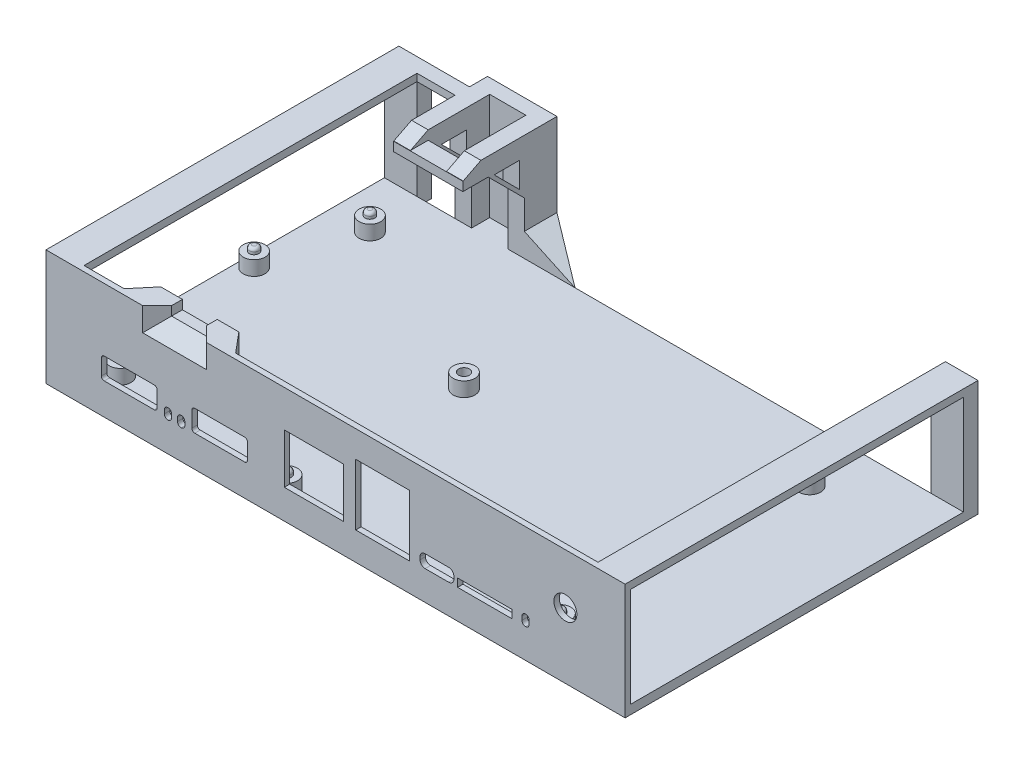
from build123d import *
from OCP.BRepFilletAPI import BRepFilletAPI_MakeChamfer

# Parameters (mm, degrees)
BOSS_EXTRUDE1_DEPTH  = 2.5
SKETCH3_W            = 160
SKETCH3_H            = 1.5
BOSS_EXTRUDE2_DEPTH  = 32
SKETCH4_R            = 3
BOSS_EXTRUDE3_DEPTH  = 4
SKETCH6_R            = 1.33
BOSS_EXTRUDE5_DEPTH  = 1.5
SKETCH7_R            = 1.5
CUT_EXTRUDE1_DEPTH   = 4
BOSS_EXTRUDE6_DEPTH  = 32
BOSS_EXTRUDE7_DEPTH  = 2.5
CHAMFER2_SIZE        = 6.5
CHAMFER2_SIZE2       = 13.939294983
CUT_EXTRUDE2_REACH   = 194.692
SKETCH11_R           = 3.175
SKETCH11_W           = 15.4
SKETCH11_H           = 5.95
SKETCH11_W_2         = 16.33
SKETCH11_H_2         = 13.74
SKETCH11_W_3         = 14.9
SKETCH11_H_3         = 16.92
SKETCH11_W_4         = 9.34
SKETCH11_H_4         = 3.56
SKETCH11_W_5         = 15.1
SKETCH11_H_5         = 2.25
SKETCH11_W_6         = 2
SKETCH11_H_6         = 3
SKETCH11_W_7         = 9.6
SKETCH11_H_7         = 2.5
FILLET1_R            = 1.4
FILLET2_R            = 0.8
FILLET3_R            = 0.8
FILLET4_R            = 1
BOSS_EXTRUDE8_DEPTH  = 5.5
CHAMFER3_SIZE        = 5.5
CHAMFER4_SIZE        = 4.6
CHAMFER4_SIZE2       = 5.482066526
CHAMFER5_SIZE        = 4
SKETCH13_W           = 4.5825757
SKETCH13_H           = 12
SKETCH13_W_2         = 4.582575695
BOSS_EXTRUDE9_DEPTH  = 5
SKETCH16_W           = 19.16515139
SKETCH16_H           = 2.5
BOSS_EXTRUDE10_DEPTH = 5
CHAMFER6_SIZE        = 2.5
CHAMFER6_SIZE_2      = 4.906526264
CHAMFER7_SIZE        = 10
CUT_EXTRUDE3_DEPTH   = 20
SKETCH18_W           = 9
SKETCH18_H           = 4
BOSS_EXTRUDE11_DEPTH = 30
SKETCH19_W           = 9
SKETCH19_H           = 96
BOSS_EXTRUDE12_DEPTH = 2


with BuildPart() as part:
    # Sketch1 → Boss-Extrude1 (new body)
    with BuildSketch(Plane(origin=(0, 0, 0), x_dir=(1, 0, 0), z_dir=(0, 1, 0))):
        Polygon((34.5, 92), (160, 92), (160, 0), (0, 0), (0, 92), (24, 92), (24, 99), (34.5, 99), align=None)
    extrude(amount=BOSS_EXTRUDE1_DEPTH)

    # Sketch3 → Boss-Extrude2 (add)
    with BuildSketch(Plane(origin=(0, 0, 0), x_dir=(1, 0, 0), z_dir=(0, 1, 0))):
        with Locations((80, -0.75)):
            Rectangle(SKETCH3_W, SKETCH3_H)
    extrude(amount=BOSS_EXTRUDE2_DEPTH)

    # Sketch4 → Boss-Extrude3 (add)
    with BuildSketch(Plane(origin=(0, 2.5, 0), x_dir=(1, 0, 0), z_dir=(0, 1, 0))):
        with Locations(Location((11, 8, 0), (0, 0, 90))):
            Circle(SKETCH4_R)
        with Locations(Location((11, 77, 0), (0, 0, 90))):
            Circle(SKETCH4_R)
        with Locations(Location((61.5, 3.5, 0), (0, 0, 90))):
            Circle(SKETCH4_R)
        with Locations(Location((132.5, 8, 0), (0, 0, 90))):
            Circle(SKETCH4_R)
        with Locations(Location((132.5, 77, 0), (0, 0, 90))):
            Circle(SKETCH4_R)
        with Locations(Location((3.5, 52.5, 0), (0, 0, 90))):
            Circle(SKETCH4_R)
        with Locations(Location((61.5, 52.5, 0), (0, 0, 90))):
            Circle(SKETCH4_R)
    extrude(amount=BOSS_EXTRUDE3_DEPTH)

    # Sketch6 → Boss-Extrude5 (add)
    with BuildSketch(Plane(origin=(0, 6.5, 0), x_dir=(1, 0, 0), z_dir=(0, 1, 0))):
        with Locations(Location((11, 77, 0), (0, 0, 270))):
            Circle(SKETCH6_R)
        with Locations(Location((3.5, 52.5, 0), (0, 0, 270))):
            Circle(SKETCH6_R)
        with Locations(Location((11, 8, 0), (0, 0, 270))):
            Circle(SKETCH6_R)
        with Locations(Location((61.5, 3.5, 0), (0, 0, 270))):
            Circle(SKETCH6_R)
        with Locations(Location((132.5, 8, 0), (0, 0, 270))):
            Circle(SKETCH6_R)
        with Locations(Location((132.5, 77, 0), (0, 0, 270))):
            Circle(SKETCH6_R)
    extrude(amount=BOSS_EXTRUDE5_DEPTH)

    # Sketch7 → Cut-Extrude1 (cut)
    with BuildSketch(Plane(origin=(0, 6.5, 0), x_dir=(1, 0, 0), z_dir=(0, 1, 0))):
        with Locations(Location((61.5, 52.5, 0), (0, 0, 270))):
            Circle(SKETCH7_R)
    extrude(amount=-CUT_EXTRUDE1_DEPTH, mode=Mode.SUBTRACT)

    # Sketch8 → Boss-Extrude6 (add)
    with BuildSketch(Plane(origin=(0, 0, 0), x_dir=(1, 0, 0), z_dir=(0, 1, 0))):
        Polygon((19.5, 92), (24.082575695, 92), (24.082575695, 97), (34.082575695, 97), (34.082575695, 92), (38.66515139, 92), (38.66515139, 99), (38.66515139, 101), (19.5, 101), (19.5, 99), align=None)
    extrude(amount=BOSS_EXTRUDE6_DEPTH)

    # Sketch10 → Boss-Extrude7 (add)
    with BuildSketch(Plane(origin=(0, 0, 0), x_dir=(1, 0, 0), z_dir=(0, 1, 0))):
        Polygon((38.66515139, 101), (38.66515139, 92), (52.66515139, 92), align=None)
    extrude(amount=BOSS_EXTRUDE7_DEPTH)

    # Chamfer2
    chamfer2_edges = [part.edges().sort_by_distance(p)[0] for p in [
        (38.66515139, 2.5, -96.5),
    ]]
    chamfer2_side = [part.faces().sort_by_distance(p)[0] for p in [
        (38.66515139, 17.25, -96.5),
    ]]
    chamfer(chamfer2_edges, length=CHAMFER2_SIZE, length2=CHAMFER2_SIZE2, reference=chamfer2_side[0])

    # Sketch11 → Cut-Extrude2 (cut, up to next)
    with BuildSketch(Plane.XY.offset(1.5), mode=Mode.PRIVATE) as cut_extrude2_sk1:
        with Locations((143.5, 18.1)):
            Circle(SKETCH11_R)
    cut_extrude2_tool1 = extrude(cut_extrude2_sk1.sketch, amount=-CUT_EXTRUDE2_REACH, mode=Mode.PRIVATE) & part.part
    # Sketch11 → Cut-Extrude2 (cut, up to next)
    with BuildSketch(Plane.XY.offset(1.5), mode=Mode.PRIVATE) as cut_extrude2_sk2:
        with Locations((23, 11.655)):
            Rectangle(SKETCH11_W, SKETCH11_H)
    cut_extrude2_tool2 = extrude(cut_extrude2_sk2.sketch, amount=-CUT_EXTRUDE2_REACH, mode=Mode.PRIVATE) & part.part
    # Sketch11 → Cut-Extrude2 (cut, up to next)
    with BuildSketch(Plane.XY.offset(1.5), mode=Mode.PRIVATE) as cut_extrude2_sk3:
        with Locations((48, 11.655)):
            Rectangle(SKETCH11_W, SKETCH11_H)
    cut_extrude2_tool3 = extrude(cut_extrude2_sk3.sketch, amount=-CUT_EXTRUDE2_REACH, mode=Mode.PRIVATE) & part.part
    # Sketch11 → Cut-Extrude2 (cut, up to next)
    with BuildSketch(Plane.XY.offset(1.5), mode=Mode.PRIVATE) as cut_extrude2_sk4:
        with Locations((74.005, 14.97)):
            Rectangle(SKETCH11_W_2, SKETCH11_H_2)
    cut_extrude2_tool4 = extrude(cut_extrude2_sk4.sketch, amount=-CUT_EXTRUDE2_REACH, mode=Mode.PRIVATE) & part.part
    # Sketch11 → Cut-Extrude2 (cut, up to next)
    with BuildSketch(Plane.XY.offset(1.5), mode=Mode.PRIVATE) as cut_extrude2_sk5:
        with Locations((93.01, 16.21)):
            Rectangle(SKETCH11_W_3, SKETCH11_H_3)
    cut_extrude2_tool5 = extrude(cut_extrude2_sk5.sketch, amount=-CUT_EXTRUDE2_REACH, mode=Mode.PRIVATE) & part.part
    # Sketch11 → Cut-Extrude2 (cut, up to next)
    with BuildSketch(Plane.XY.offset(1.5), mode=Mode.PRIVATE) as cut_extrude2_sk6:
        with Locations((108.01, 9.88)):
            Rectangle(SKETCH11_W_4, SKETCH11_H_4)
    cut_extrude2_tool6 = extrude(cut_extrude2_sk6.sketch, amount=-CUT_EXTRUDE2_REACH, mode=Mode.PRIVATE) & part.part
    # Sketch11 → Cut-Extrude2 (cut, up to next)
    with BuildSketch(Plane.XY.offset(1.5), mode=Mode.PRIVATE) as cut_extrude2_sk7:
        with Locations((121.26, 9.225)):
            Rectangle(SKETCH11_W_5, SKETCH11_H_5)
    cut_extrude2_tool7 = extrude(cut_extrude2_sk7.sketch, amount=-CUT_EXTRUDE2_REACH, mode=Mode.PRIVATE) & part.part
    # Sketch11 → Cut-Extrude2 (cut, up to next)
    with BuildSketch(Plane.XY.offset(1.5), mode=Mode.PRIVATE) as cut_extrude2_sk8:
        with Locations((33.7, 9.6)):
            Rectangle(SKETCH11_W_6, SKETCH11_H_6)
    cut_extrude2_tool8 = extrude(cut_extrude2_sk8.sketch, amount=-CUT_EXTRUDE2_REACH, mode=Mode.PRIVATE) & part.part
    # Sketch11 → Cut-Extrude2 (cut, up to next)
    with BuildSketch(Plane.XY.offset(1.5), mode=Mode.PRIVATE) as cut_extrude2_sk9:
        with Locations((37.35, 9.6)):
            Rectangle(SKETCH11_W_6, SKETCH11_H_6)
    cut_extrude2_tool9 = extrude(cut_extrude2_sk9.sketch, amount=-CUT_EXTRUDE2_REACH, mode=Mode.PRIVATE) & part.part
    # Sketch11 → Cut-Extrude2 (cut, up to next)
    with BuildSketch(Plane.XY.offset(1.5), mode=Mode.PRIVATE) as cut_extrude2_sk10:
        with Locations((132.5, 9.6)):
            Rectangle(SKETCH11_W_6, SKETCH11_H_6)
    cut_extrude2_tool10 = extrude(cut_extrude2_sk10.sketch, amount=-CUT_EXTRUDE2_REACH, mode=Mode.PRIVATE) & part.part
    # Sketch11 → Cut-Extrude2 (cut, up to next)
    with BuildSketch(Plane.XY.offset(1.5), mode=Mode.PRIVATE) as cut_extrude2_sk11:
        with Locations((35.5, 30.75)):
            Rectangle(SKETCH11_W_7, SKETCH11_H_7)
    cut_extrude2_tool11 = extrude(cut_extrude2_sk11.sketch, amount=-CUT_EXTRUDE2_REACH, mode=Mode.PRIVATE) & part.part
    add(cut_extrude2_tool1.solids().sort_by_distance((143.5, 18.1, 1.5))[0], mode=Mode.SUBTRACT)
    add(cut_extrude2_tool2.solids().sort_by_distance((23, 11.655, 1.5))[0], mode=Mode.SUBTRACT)
    add(cut_extrude2_tool3.solids().sort_by_distance((48, 11.655, 1.5))[0], mode=Mode.SUBTRACT)
    add(cut_extrude2_tool4.solids().sort_by_distance((74.005, 14.97, 1.5))[0], mode=Mode.SUBTRACT)
    add(cut_extrude2_tool5.solids().sort_by_distance((93.01, 16.21, 1.5))[0], mode=Mode.SUBTRACT)
    add(cut_extrude2_tool6.solids().sort_by_distance((108.01, 9.88, 1.5))[0], mode=Mode.SUBTRACT)
    add(cut_extrude2_tool7.solids().sort_by_distance((121.26, 9.225, 1.5))[0], mode=Mode.SUBTRACT)
    add(cut_extrude2_tool8.solids().sort_by_distance((33.7, 9.6, 1.5))[0], mode=Mode.SUBTRACT)
    add(cut_extrude2_tool9.solids().sort_by_distance((37.35, 9.6, 1.5))[0], mode=Mode.SUBTRACT)
    add(cut_extrude2_tool10.solids().sort_by_distance((132.5, 9.6, 1.5))[0], mode=Mode.SUBTRACT)
    add(cut_extrude2_tool11.solids().sort_by_distance((35.5, 30.75, 1.5))[0], mode=Mode.SUBTRACT)

    # Fillet1
    fillet1_edges = [part.edges().sort_by_distance(p)[0] for p in [
        (103.34, 8.1, 0.75),
        (103.34, 11.66, 0.75),
        (112.68, 11.66, 0.75),
        (112.68, 8.1, 0.75),
    ]]
    fillet(fillet1_edges, radius=FILLET1_R)

    # Fillet2
    fillet2_edges = [part.edges().sort_by_distance(p)[0] for p in [
        (40.3, 8.68, 0.75),
        (40.3, 14.63, 0.75),
        (55.7, 14.63, 0.75),
        (55.7, 8.68, 0.75),
        (15.3, 8.68, 0.75),
        (15.3, 14.63, 0.75),
        (30.7, 14.63, 0.75),
        (30.7, 8.68, 0.75),
    ]]
    fillet(fillet2_edges, radius=FILLET2_R)

    # Fillet3
    fillet3_edges = [part.edges().sort_by_distance(p)[0] for p in [
        (11, 8, -78.33),
        (3.5, 8, -53.83),
        (11, 8, -9.33),
        (61.5, 8, -4.83),
        (132.5, 8, -9.33),
        (132.5, 8, -78.33),
    ]]
    fillet(fillet3_edges, radius=FILLET3_R)

    # Fillet4
    fillet4_edges = [part.edges().sort_by_distance(p)[0] for p in [
        (34.7, 8.1, 0.75),
        (38.35, 8.1, 0.75),
        (38.35, 11.1, 0.75),
        (34.7, 11.1, 0.75),
        (32.7, 8.1, 0.75),
        (36.35, 8.1, 0.75),
        (36.35, 11.1, 0.75),
        (32.7, 11.1, 0.75),
        (131.5, 11.1, 0.75),
        (133.5, 11.1, 0.75),
        (131.5, 8.1, 0.75),
        (133.5, 8.1, 0.75),
    ]]
    fillet(fillet4_edges, radius=FILLET4_R - 0.0001)  # a hair under: the kernel refuses the full size

    # Sketch12 → Boss-Extrude8 (add)
    with BuildSketch(Plane(origin=(0, 0, 0), x_dir=(-1, 0, 0), z_dir=(0, 0, -1))):
        Polygon((-40.3, 29.5), (-30.7, 29.5), (-30.7, 32), (-24.7, 32), (-24.7, 26.5), (-30.7, 26.5), (-40.3, 26.5), (-46.3, 26.5), (-46.3, 32), (-40.3, 32), align=None)
    extrude(amount=BOSS_EXTRUDE8_DEPTH)

    # Chamfer3
    chamfer3_edges = [part.edges().sort_by_distance(p)[0] for p in [
        (35.5, 26.5, 0),
    ]]
    chamfer(chamfer3_edges, length=CHAMFER3_SIZE - 0.0001)  # a hair under: the kernel refuses the full size

    # Chamfer4
    chamfer4_edges = [part.edges().sort_by_distance(p)[0] for p in [
        (46.3, 26.50005, 0),
        (24.7, 26.50005, 0),
    ]]
    chamfer4_side = [part.faces().sort_by_distance(p)[0] for p in [
        (83.404597231, 17.301616567, 0),
    ]]
    chamfer(chamfer4_edges, length=CHAMFER4_SIZE, length2=CHAMFER4_SIZE2, reference=chamfer4_side[0])

    # Chamfer5
    chamfer5_edges = [part.edges().sort_by_distance(p)[0] for p in [
        (30.7, 30.75, 1.5),
        (35.5, 29.5, 1.5),
        (40.3, 30.75, 1.5),
    ]]
    chamfer(chamfer5_edges, length=CHAMFER5_SIZE)

    # Sketch13 → Boss-Extrude9 (add)
    with BuildSketch(Plane(origin=(0, 32, 0), x_dir=(1, 0, 0), z_dir=(0, 1, 0))):
        with Locations((21.79128785, 86)):
            Rectangle(SKETCH13_W, SKETCH13_H)
        with Locations((36.373863543, 86)):
            Rectangle(SKETCH13_W_2, SKETCH13_H)
    extrude(amount=-BOSS_EXTRUDE9_DEPTH)

    # Sketch16 → Boss-Extrude10 (add)
    with BuildSketch(Plane.XY.offset(-80)):
        with Locations((29.082575695, 28.25)):
            Rectangle(SKETCH16_W, SKETCH16_H)
    extrude(amount=BOSS_EXTRUDE10_DEPTH)

    # Chamfer6
    chamfer6_edges_1 = [part.edges().sort_by_distance(p)[0] for p in [
        (21.79128785, 29.5, -80),
    ]]
    chamfer6_side_1 = [part.faces().sort_by_distance(p)[0] for p in [
        (21.79128785, 29.55, -80),
    ]]
    chamfer6_edges_2 = [part.edges().sort_by_distance(p)[0] for p in [
        (36.373863542, 29.5, -80),
    ]]
    chamfer6_side_2 = [part.faces().sort_by_distance(p)[0] for p in [
        (36.373863542, 29.55, -80),
    ]]
    chamfer6 = BRepFilletAPI_MakeChamfer(part.part.solid().wrapped)
    for e in chamfer6_edges_1:
        chamfer6.Add(CHAMFER6_SIZE - 0.0001, CHAMFER6_SIZE_2 - 0.0001, e.wrapped, chamfer6_side_1[0].wrapped)
    for e in chamfer6_edges_2:
        chamfer6.Add(CHAMFER6_SIZE - 0.0001, CHAMFER6_SIZE_2 - 0.0001, e.wrapped, chamfer6_side_2[0].wrapped)
    add(Compound.cast(chamfer6.Shape()), mode=Mode.REPLACE)  # a hair under: the kernel refuses the full size

    # Chamfer7
    chamfer7_edges = [part.edges().sort_by_distance(p)[0] for p in [
        (36.373863542, 27, -92),
        (21.79128785, 27, -92),
    ]]
    chamfer(chamfer7_edges, length=CHAMFER7_SIZE)

    # Sketch17 → Cut-Extrude3 (cut)
    with BuildSketch(Plane.ZY.offset(-19.5)):
        Polygon((-90.658359214, 19.683281573), (-90.658359214, 26.683281573), (-83.658359214, 26.683281573), align=None)
    extrude(amount=-CUT_EXTRUDE3_DEPTH, mode=Mode.SUBTRACT)

    # Sketch18 → Boss-Extrude11 (add)
    with BuildSketch(Plane(origin=(0, 0, 0), x_dir=(1, 0, 0), z_dir=(0, 1, 0))):
        with Locations((4.5, 94)):
            Rectangle(SKETCH18_W, SKETCH18_H)
        with Locations((155.5, 94)):
            Rectangle(SKETCH18_W, SKETCH18_H)
    extrude(amount=BOSS_EXTRUDE11_DEPTH)

    # Sketch19 → Boss-Extrude12 (add)
    with BuildSketch(Plane(origin=(0, 30, 0), x_dir=(1, 0, 0), z_dir=(0, 1, 0))):
        Polygon((0, 96), (9, 96), (19.5, 96), (19.5, 92), (9, 92), (9, 0), (0, 0), align=None)
        with Locations((155.5, 48)):
            Rectangle(SKETCH19_W, SKETCH19_H)
    extrude(amount=BOSS_EXTRUDE12_DEPTH)


solid = part.part
